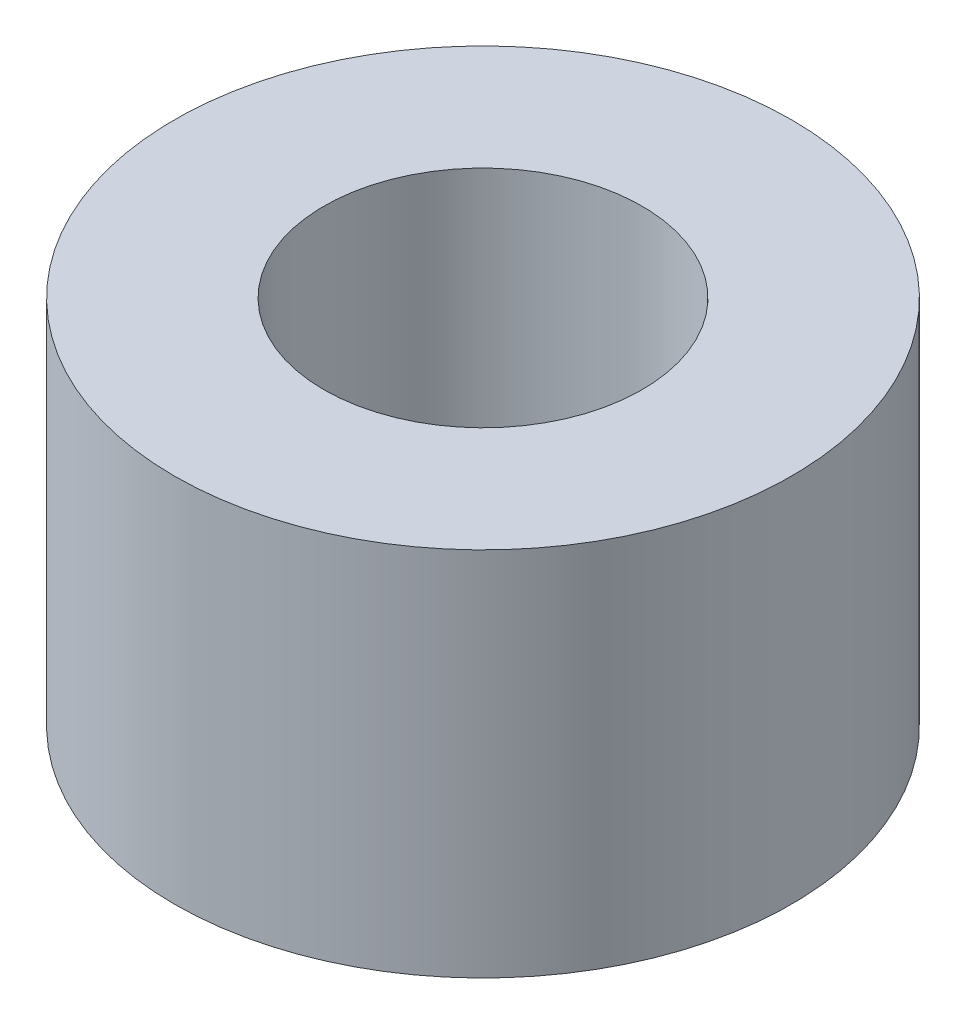
from build123d import *

# Parameters (mm, degrees)
SKETCH1_R           = 6.5532
SKETCH1_R_2         = 3.3782
BOSS_EXTRUDE1_DEPTH = 7.874


with BuildPart() as part:
    # Sketch1 → Boss-Extrude1 (new body)
    with BuildSketch(Plane(origin=(0, 0, 0), x_dir=(1, 0, 0), z_dir=(0, 1, 0))):
        Circle(SKETCH1_R)
        Circle(SKETCH1_R_2, mode=Mode.SUBTRACT)
    extrude(amount=BOSS_EXTRUDE1_DEPTH)


solid = part.part
